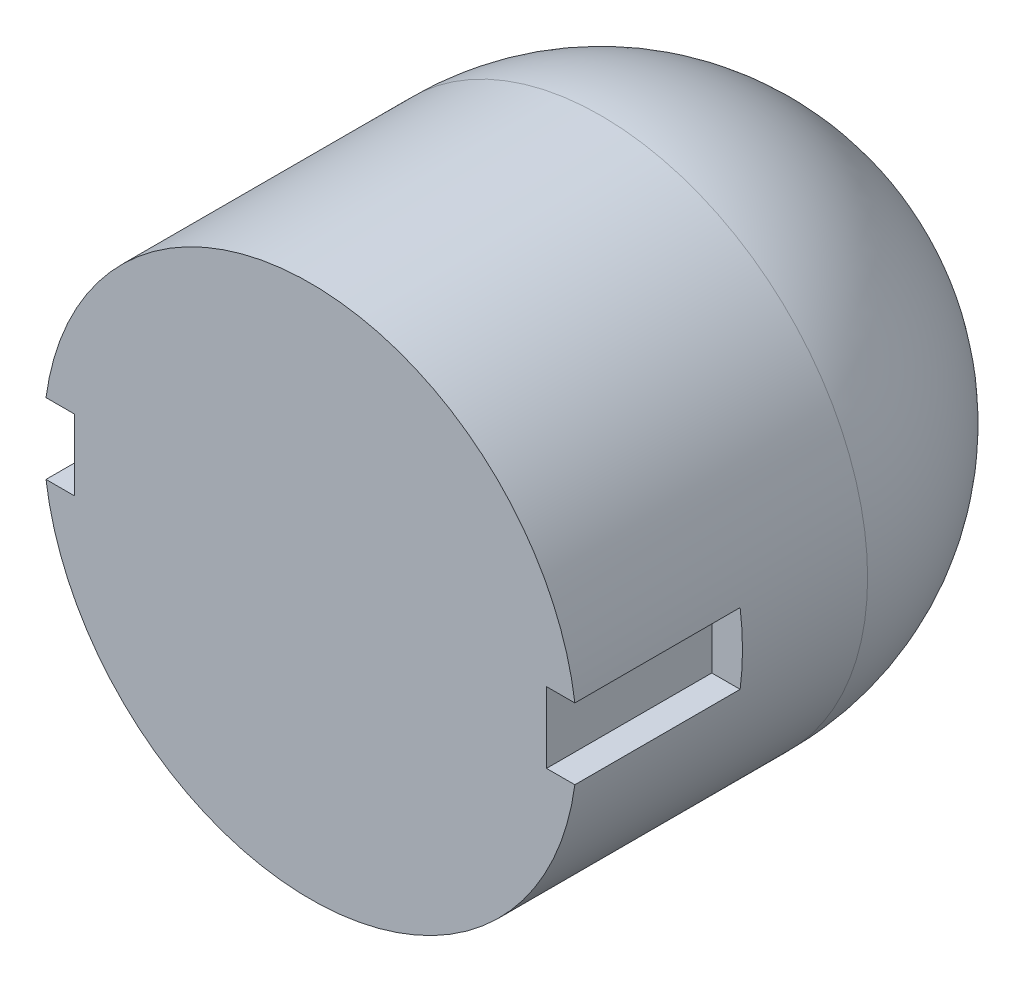
from build123d import *

# Parameters (mm, degrees)
REVOLVE1_ANGLE      = 180
SKETCH3_R           = 5.65
BOSS_EXTRUDE1_DEPTH = 6.15
CUT_EXTRUDE1_REACH  = 17.083
CUT_EXTRUDE1_START  = -5
SKETCH5_W           = 3.5
SKETCH5_H           = 1.5
CUT_EXTRUDE2_REACH  = 17.083
CUT_EXTRUDE2_START  = 5
SKETCH5_2_W         = 3.5
SKETCH5_2_H         = 1.5


with BuildPart() as part:
    # Sketch1 → Revolve1 (revolve)
    with BuildSketch(Plane.XY):
        with BuildLine():
            Line((0, 5.65), (0, -5.65))
            ThreePointArc((0, -5.65), (5.65, 0), (0, 5.65))
        make_face()
    revolve(axis=Axis((0, 5.65, 0), (0, 1, 0)), revolution_arc=REVOLVE1_ANGLE)

    # Sketch3 → Boss-Extrude1 (add)
    with BuildSketch(Plane.XY):
        Circle(SKETCH3_R)
    extrude(amount=BOSS_EXTRUDE1_DEPTH)

    # Sketch5 → Cut-Extrude1 (cut, up to next)
    with BuildSketch(Plane(origin=(0, 0, 0), x_dir=(0, 0, -1), z_dir=(1, 0, 0)).offset(CUT_EXTRUDE1_START), mode=Mode.PRIVATE) as cut_extrude1_sk1:
        with Locations((-4.4, 0)):
            Rectangle(SKETCH5_W, SKETCH5_H)
    cut_extrude1_tool1 = extrude(cut_extrude1_sk1.sketch, amount=-CUT_EXTRUDE1_REACH, mode=Mode.PRIVATE) & part.part
    add(cut_extrude1_tool1.solids().sort_by_distance((-5, 0, 4.4))[0], mode=Mode.SUBTRACT)

    # Sketch5<2> → Cut-Extrude2 (cut, up to next)
    with BuildSketch(Plane(origin=(0, 0, 0), x_dir=(0, 0, -1), z_dir=(1, 0, 0)).offset(CUT_EXTRUDE2_START), mode=Mode.PRIVATE) as cut_extrude2_sk1:
        with Locations((-4.4, 0)):
            Rectangle(SKETCH5_2_W, SKETCH5_2_H)
    cut_extrude2_tool1 = extrude(cut_extrude2_sk1.sketch, amount=CUT_EXTRUDE2_REACH, mode=Mode.PRIVATE) & part.part
    add(cut_extrude2_tool1.solids().sort_by_distance((5, 0, 4.4))[0], mode=Mode.SUBTRACT)


solid = part.part
